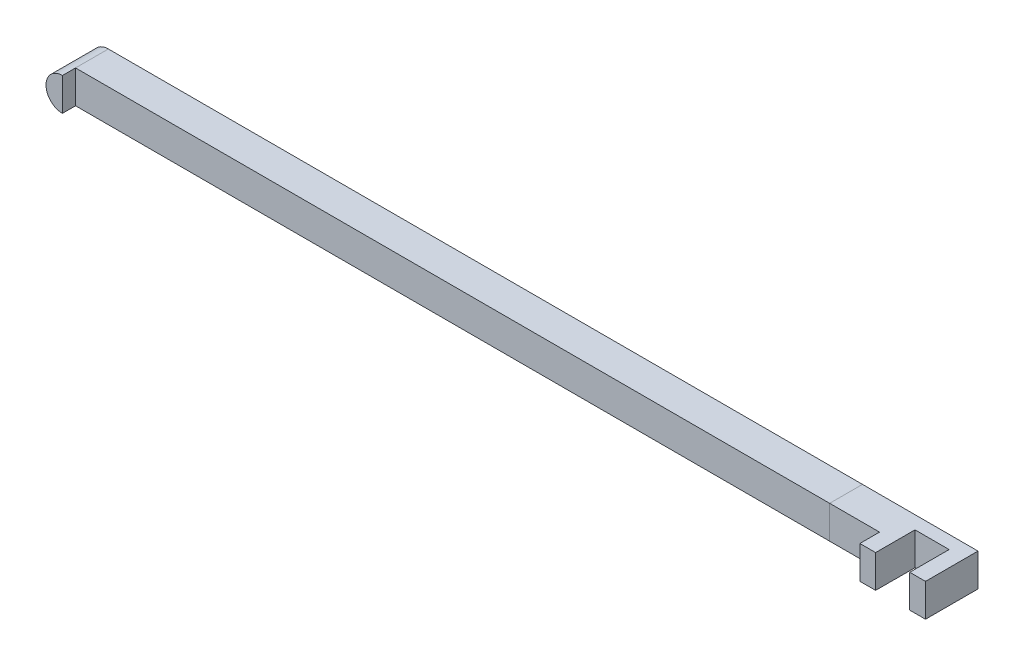
from build123d import *

# Parameters (mm, degrees)
SKETCH1_W              = 125
SKETCH1_H              = 5
BOSS_EXTRUDE1_DEPTH    = 5
FILLET1_R              = 2.5
SKETCH3_W              = 5
SKETCH3_H              = 5
BOSS_EXTRUDE2_DEPTH    = 10
SKETCH4_W              = 5.2
SKETCH4_H              = 5
CUT_EXTRUDE1_DEPTH     = 3
BOSS_EXTRUDE3_DEPTH    = 2
SKETCH7_W              = 2.4
SKETCH7_H              = 4.991403031
SKETCH7_H_2            = 5
BOSS_EXTRUDE4_DEPTH    = 3
SPLIT1_SURFACE_1_BACK  = 136.329
SPLIT1_SURFACE_1_DEPTH = 272.658
SPLIT1_SURFACE_2_BACK  = 136.329
SPLIT1_SURFACE_2_DEPTH = 272.658


with BuildPart() as part:
    # Sketch1 → Boss-Extrude1 (new body)
    with BuildSketch(Plane(origin=(0, 0, 0), x_dir=(-1, 0, 0), z_dir=(0, 1, 0))):
        Rectangle(SKETCH1_W, SKETCH1_H)
    extrude(amount=BOSS_EXTRUDE1_DEPTH)

    # Fillet1
    fillet1_edges = [part.edges().sort_by_distance(p)[0] for p in [
        (-62.5, 5, 0),
        (-62.5, 0, 0),
    ]]
    fillet(fillet1_edges, radius=FILLET1_R - 0.0001)  # a hair under: the kernel refuses the full size

    # Sketch3 → Boss-Extrude2 (add)
    with BuildSketch(Plane.YZ.offset(62.5)):
        with Locations((2.5, 0)):
            Rectangle(SKETCH3_W, SKETCH3_H)
    extrude(amount=BOSS_EXTRUDE2_DEPTH)

    # Sketch4 → Cut-Extrude1 (cut)
    with BuildSketch(Plane.XY.offset(2.5)):
        with Locations((67.5, 2.5)):
            Rectangle(SKETCH4_W, SKETCH4_H)
    extrude(amount=-CUT_EXTRUDE1_DEPTH, mode=Mode.SUBTRACT)

    # Sketch5 → Boss-Extrude3 (add)
    with BuildSketch(Plane.XY.offset(2.5)):
        with BuildLine():
            Line((-60, 0), (-60, 5))
            ThreePointArc((-60, 5), (-62.5, 2.5), (-60, 0))
        make_face()
    extrude(amount=BOSS_EXTRUDE3_DEPTH)

    # Sketch7 → Boss-Extrude4 (add)
    with BuildSketch(Plane.XY.offset(2.5)):
        with Locations((63.7, 2.504298485)):
            Rectangle(SKETCH7_W, SKETCH7_H)
        with Locations((71.3, 2.5)):
            Rectangle(SKETCH7_W, SKETCH7_H_2)
    extrude(amount=BOSS_EXTRUDE4_DEPTH)


with BuildPart() as body_2:
    # Split1: the piece behind the surface
    add(part.part)
    # Split1 surface: a surface, the sketch's curves swept straight by 272.658 mm
    with BuildLine(Plane.XY.offset(2.5).offset(-SPLIT1_SURFACE_1_BACK), mode=Mode.PRIVATE) as split1_surface_1_path:
        Line((54.9, 5), (54.9, 0))
    split1_surface_1 = Shell.extrude(split1_surface_1_path.wire(), (0 * SPLIT1_SURFACE_1_DEPTH, 0 * SPLIT1_SURFACE_1_DEPTH, 1 * SPLIT1_SURFACE_1_DEPTH))
    split(bisect_by=split1_surface_1, keep=Keep.BOTTOM)


with BuildPart() as part_1:
    add(part.part)

    # Split1: split by a surface, the side it looks to stays
    # Split1 surface: a surface, the sketch's curves swept straight by 272.658 mm
    with BuildLine(Plane.XY.offset(2.5).offset(-SPLIT1_SURFACE_2_BACK), mode=Mode.PRIVATE) as split1_surface_2_path:
        Line((54.9, 5), (54.9, 0))
    split1_surface_2 = Shell.extrude(split1_surface_2_path.wire(), (0 * SPLIT1_SURFACE_2_DEPTH, 0 * SPLIT1_SURFACE_2_DEPTH, 1 * SPLIT1_SURFACE_2_DEPTH))
    split(bisect_by=split1_surface_2, keep=Keep.TOP)


solid = Compound([body_2.part, part_1.part])
